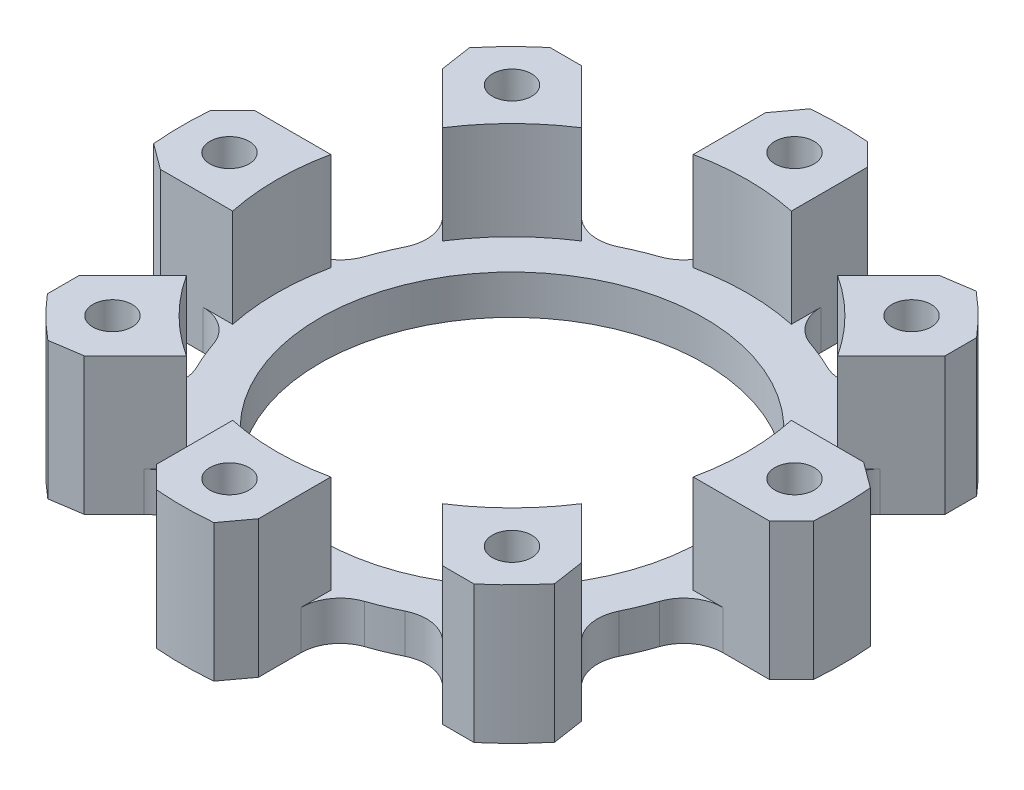
from build123d import *

# Parameters (mm, degrees)
SKETCH1_R                                       = 38.1
BASE_EXTRUDE_DEPTH                              = 6.35
COLUMN_DEPTH                                    = 22.225
SKETCH3_R                                       = 3.175
FASTENER_HOLE_CUT_DEPTH                         = 70.215
RELIEF_FILLET_R                                 = 6.35
COSMETIC_CHAMFER_SIZE                           = 3.175
COSMETIC_CHAMFER_SIZE_2                         = 3.779508342
COLUMN_AND_HOLE_PATTERN_COUNT                   = 8
RELIEF_FILLET_OF_COLUMN_AND_HOLE_PATTERN_R      = 6.35
COSMETIC_CHAMFER_OF_COLUMN_AND_HOLE_PATT_SIZE   = 3.175
COSMETIC_CHAMFER_OF_COLUMN_AND_HOLE_PATT_SIZE_2 = 3.779508342
SKETCH4_R                                       = 31.115
ACCESS_HOLE_CUT_DEPTH                           = 79.640077728
SKETCH7_R                                       = 4.7625
COUNTER_BORE_CUT_DEPTH                          = 6.604
COUNTER_BORE_PATTERN_COUNT                      = 8


with BuildPart() as part:
    # Sketch1 → Base Extrude (new body)
    with BuildSketch(Plane(origin=(0, 0, 0), x_dir=(1, 0, 0), z_dir=(0, 1, 0))):
        with Locations(Location((0, 0, 0), (0, 0, 270))):
            Circle(SKETCH1_R)
    extrude(amount=BASE_EXTRUDE_DEPTH)

    # Sketch2 → Column (add)
    with BuildSketch(Plane(origin=(0, 0, 0), x_dir=(1, 0, 0), z_dir=(0, 1, 0))):
        with BuildLine():
            Line((-7.9375, 37.264005337), (-7.9375, 52.746105958))
            ThreePointArc((-7.9375, 52.746105958), (0, 53.34), (7.9375, 52.746105958))
            Line((7.9375, 52.746105958), (7.9375, 37.264005337))
            ThreePointArc((7.9375, 37.264005337), (0, 38.1), (-7.9375, 37.264005337))
        make_face()
    column = extrude(amount=COLUMN_DEPTH)

    # Sketch3 → Fastener Hole Cut (cut, through all)
    with BuildSketch(Plane(origin=(0, 0, 0), x_dir=(1, 0, 0), z_dir=(0, 1, 0))):
        with Locations(Location((0, 45.72, 0), (0, 0, 270))):
            Circle(SKETCH3_R)
    fastener_hole_cut = extrude(amount=FASTENER_HOLE_CUT_DEPTH, mode=Mode.SUBTRACT)

    # Relief Fillet
    relief_fillet_edges = [part.edges().sort_by_distance(p)[0] for p in [
        (-7.9375, 3.175, -37.264005337),
        (7.9375, 3.175, -37.264005337),
    ]]
    fillet(relief_fillet_edges, radius=RELIEF_FILLET_R)

    # Cosmetic Chamfer
    # the kernel refuses this chamfer: 3.779508342, 3.175 mm, written as the material it takes off along each edge
    with BuildSketch(Plane(origin=(7.9375, -9.338283517, -52.746105958), x_dir=(0, 0, 1), z_dir=(0, 1, 0))) as cosmetic_chamfer_piece_1:
        with BuildLine():
            Line((COSMETIC_CHAMFER_SIZE, 0), (-0.416553381, -3.591553381))
            ThreePointArc((-0.416553381, -3.591553381), (-0.245508575, -1.851089796), (0, 0))
            Line((0, 0), (COSMETIC_CHAMFER_SIZE, 0))
        make_face()
    extrude(amount=40.901567034, mode=Mode.SUBTRACT)
    with BuildSketch(Plane(origin=(-7.9375, -9.75540011, -52.746105958), x_dir=(0.9927578423124379, 0, -0.12013270382020406), z_dir=(0, 1, 0))) as cosmetic_chamfer_piece_2:
        with BuildLine():
            Line((3.086966097, 0), (-COSMETIC_CHAMFER_SIZE_2 * 0.120132703811, -COSMETIC_CHAMFER_SIZE_2 * 0.99275784224))
            Line((-COSMETIC_CHAMFER_SIZE_2 * 0.120132703811, -COSMETIC_CHAMFER_SIZE_2 * 0.99275784224), (0, 0))
            ThreePointArc((0, 0), (1.59533256, 0.022311122), (3.086966097, 0))
        make_face()
    extrude(amount=41.735800221, mode=Mode.SUBTRACT)

    # Column and Hole Pattern: Column, Fastener Hole Cut ×8 about axis
    column_and_hole_pattern_axis = Axis((0, 0, 0), (0, 1, 0))
    add([column.rotate(column_and_hole_pattern_axis, i * 360 / COLUMN_AND_HOLE_PATTERN_COUNT) for i in range(1, COLUMN_AND_HOLE_PATTERN_COUNT)])
    add([fastener_hole_cut.rotate(column_and_hole_pattern_axis, i * 360 / COLUMN_AND_HOLE_PATTERN_COUNT) for i in range(1, COLUMN_AND_HOLE_PATTERN_COUNT)], mode=Mode.SUBTRACT)

    # Relief Fillet of Column and Hole Pattern
    relief_fillet_of_column_and_hole_pattern_edges = [part.edges().sort_by_distance(p)[0] for p in [
        (-31.962290944, 3.175, -20.736970792),
        (-20.736970792, 3.175, -31.962290944),
        (-37.264005337, 3.175, 7.9375),
        (-37.264005337, 3.175, -7.9375),
        (-20.736970792, 3.175, 31.962290944),
        (-31.962290944, 3.175, 20.736970792),
        (7.9375, 3.175, 37.264005337),
        (-7.9375, 3.175, 37.264005337),
        (31.962290944, 3.175, 20.736970792),
        (20.736970792, 3.175, 31.962290944),
        (37.264005337, 3.175, -7.9375),
        (37.264005337, 3.175, 7.9375),
        (20.736970792, 3.175, -31.962290944),
        (31.962290944, 3.175, -20.736970792),
    ]]
    fillet(relief_fillet_of_column_and_hole_pattern_edges, radius=RELIEF_FILLET_OF_COLUMN_AND_HOLE_PATTERN_R)

    # Cosmetic Chamfer of Column and Hole Patt
    # the kernel refuses this chamfer: 3.779508342, 3.175 mm, written as the material it takes off along each edge
    with BuildSketch(Plane(origin=(-31.684469129, -9.338283517, -42.90978928), x_dir=(0.7071067811865475, 0, 0.7071067811865475), z_dir=(0, 1, 0)), Plane(origin=(-52.746105958, -9.338283517, -7.9375), x_dir=(1, 0, 0), z_dir=(0, 1, 0)), Plane(origin=(-42.90978928, -9.338283517, 31.684469129), x_dir=(0.7071067811865475, 0, -0.7071067811865475), z_dir=(0, 1, 0))) as cosmetic_chamfer_of_column_and_hole_patt_piece_1:
        with BuildLine():
            Line((COSMETIC_CHAMFER_OF_COLUMN_AND_HOLE_PATT_SIZE, 0), (-0.416553381, -3.591553381))
            ThreePointArc((-0.416553381, -3.591553381), (-0.245508575, -1.851089796), (0, 0))
            Line((0, 0), (COSMETIC_CHAMFER_OF_COLUMN_AND_HOLE_PATT_SIZE, 0))
        make_face()
    extrude(amount=40.901567034, mode=Mode.SUBTRACT)
    with BuildSketch(Plane(origin=(-42.90978928, -9.75540011, -31.684469129), x_dir=(0.6170391528617065, 0, -0.7869324518887931), z_dir=(0, 1, 0)), Plane(origin=(-52.746105958, -9.75540011, 7.9375), x_dir=(-0.12013270382020397, 0, -0.9927578423124379), z_dir=(0, 1, 0)), Plane(origin=(-31.684469129, -9.75540011, 42.90978928), x_dir=(-0.7869324518887931, 0, -0.6170391528617065), z_dir=(0, 1, 0))) as cosmetic_chamfer_of_column_and_hole_patt_piece_2:
        with BuildLine():
            Line((3.086966097, 0), (-COSMETIC_CHAMFER_OF_COLUMN_AND_HOLE_PATT_SIZE_2 * 0.120132703811, -COSMETIC_CHAMFER_OF_COLUMN_AND_HOLE_PATT_SIZE_2 * 0.99275784224))
            Line((-COSMETIC_CHAMFER_OF_COLUMN_AND_HOLE_PATT_SIZE_2 * 0.120132703811, -COSMETIC_CHAMFER_OF_COLUMN_AND_HOLE_PATT_SIZE_2 * 0.99275784224), (0, 0))
            ThreePointArc((0, 0), (1.59533256, 0.022311122), (3.086966097, 0))
        make_face()
    extrude(amount=41.735800221, mode=Mode.SUBTRACT)
    with BuildSketch(Plane(origin=(-7.9375, -9.338283517, 52.746105958), x_dir=(0.9933412613393439, 0, 0.11520910780299275), z_dir=(0, 1, 0)), Plane(origin=(31.684469129, -9.338283517, 42.90978928), x_dir=(0.7838634833073986, 0, -0.6209332005434978), z_dir=(0, 1, 0)), Plane(origin=(52.746105958, -9.338283517, 7.9375), x_dir=(0.11520910780299462, 0, -0.9933412613393435), z_dir=(0, 1, 0)), Plane(origin=(42.90978928, -9.338283517, -31.684469129), x_dir=(-0.620933200543497, 0, -0.7838634833073992), z_dir=(0, 1, 0))) as cosmetic_chamfer_of_column_and_hole_patt_piece_3:
        with BuildLine():
            Line((3.615628909, 0), (-COSMETIC_CHAMFER_OF_COLUMN_AND_HOLE_PATT_SIZE * 0.115209107803, COSMETIC_CHAMFER_OF_COLUMN_AND_HOLE_PATT_SIZE * 0.993341261339))
            Line((-COSMETIC_CHAMFER_OF_COLUMN_AND_HOLE_PATT_SIZE * 0.115209107803, COSMETIC_CHAMFER_OF_COLUMN_AND_HOLE_PATT_SIZE * 0.993341261339), (0, 0))
            ThreePointArc((0, 0), (1.867048697, -0.030611394), (3.615628909, 0))
        make_face()
    extrude(amount=40.901567034, mode=Mode.SUBTRACT)
    with BuildSketch(Plane(origin=(7.9375, -9.75540011, 52.746105958), x_dir=(0, 0, -1), z_dir=(0, 1, 0)), Plane(origin=(42.90978928, -9.75540011, 31.684469129), x_dir=(-0.707106781186548, 0, -0.707106781186547), z_dir=(0, 1, 0)), Plane(origin=(52.746105958, -9.75540011, -7.9375), x_dir=(-1, 0, 0), z_dir=(0, 1, 0)), Plane(origin=(31.684469129, -9.75540011, -42.90978928), x_dir=(-0.707106781186548, 0, 0.707106781186547), z_dir=(0, 1, 0))) as cosmetic_chamfer_of_column_and_hole_patt_piece_4:
        with BuildLine():
            Line((COSMETIC_CHAMFER_OF_COLUMN_AND_HOLE_PATT_SIZE_2, 0), (-0.370845584, 3.064609802))
            ThreePointArc((-0.370845584, 3.064609802), (-0.213801155, 1.581098614), (0, 0))
            Line((0, 0), (COSMETIC_CHAMFER_OF_COLUMN_AND_HOLE_PATT_SIZE_2, 0))
        make_face()
    extrude(amount=41.735800221, mode=Mode.SUBTRACT)

    # Sketch4 → Access Hole Cut (cut, through all)
    with BuildSketch(Plane(origin=(0, 0, 0), x_dir=(1, 0, 0), z_dir=(0, 1, 0))):
        with Locations(Location((0, 0, 0), (0, 0, 270))):
            Circle(SKETCH4_R)
    extrude(amount=ACCESS_HOLE_CUT_DEPTH, mode=Mode.SUBTRACT)

    # Sketch7 → Counter Bore Cut (cut)
    with BuildSketch(Plane(origin=(0, 0, 0), x_dir=(1, 0, 0), z_dir=(0, 1, 0))):
        with Locations(Location((0, 45.72, 0), (0, 0, 90))):
            Circle(SKETCH7_R)
    counter_bore_cut = extrude(amount=COUNTER_BORE_CUT_DEPTH, mode=Mode.SUBTRACT)

    # Counter Bore Pattern: Counter Bore Cut ×8 about axis
    counter_bore_pattern_axis = Axis((0, 0, 0), (0, 1, 0))
    for i in range(1, COUNTER_BORE_PATTERN_COUNT):
        add(counter_bore_cut.rotate(counter_bore_pattern_axis, i * 360 / COUNTER_BORE_PATTERN_COUNT), mode=Mode.SUBTRACT)


solid = part.part
